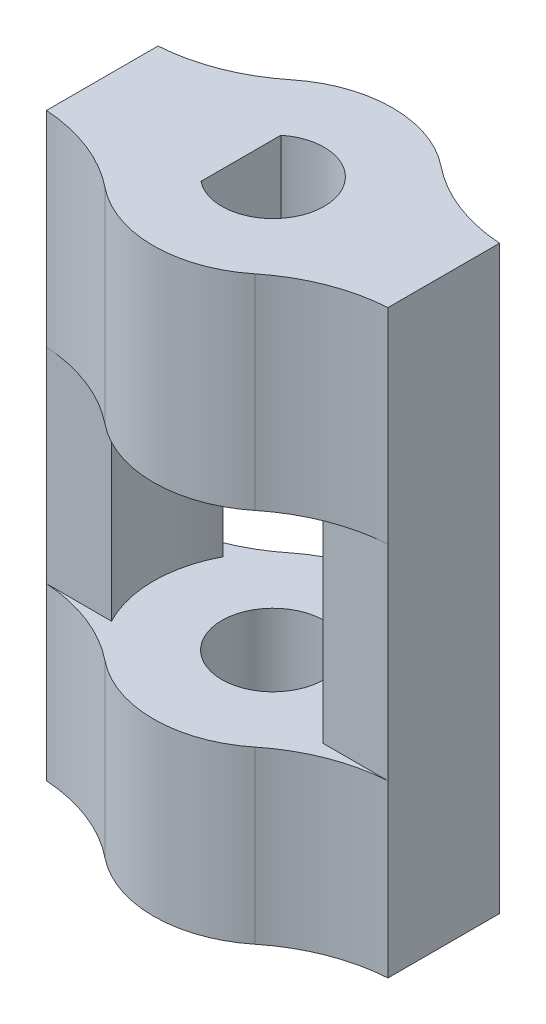
from build123d import *

# Parameters (mm, degrees)
BOSS_EXTRUDE1_DEPTH = 10
BOSS_EXTRUDE2_START = 10
BOSS_EXTRUDE2_DEPTH = 12
BOSS_EXTRUDE3_START = 22
BOSS_EXTRUDE3_DEPTH = 12
FILLET1_R           = 10


with BuildPart() as part:
    # Sketch1 → Boss-Extrude1 (new body)
    # profile 1 of 5: a face of its own
    with BuildSketch(Plane(origin=(0, 0, 0), x_dir=(1, 0, 0), z_dir=(0, 1, 0))):
        with BuildLine():
            Line((-10, 3.266604118), (-10, -3.266604118))
            Line((-10, -3.266604118), (-6.191065945, -3.266604118))
            ThreePointArc((-6.191065945, -3.266604118), (-7, 0), (-6.191065945, 3.266604118))
            Line((-6.191065945, 3.266604118), (-10, 3.266604118))
        make_face()
    # profile 2 of 5: a face of its own
    with BuildSketch(Plane(origin=(0, 0, 0), x_dir=(1, 0, 0), z_dir=(0, 1, 0))):
        with BuildLine():
            ThreePointArc((6.191065945, 3.266604118), (0, 7), (-6.191065945, 3.266604118))
            Line((-6.191065945, 3.266604118), (6.191065945, 3.266604118))
        make_face()
    # profile 3 of 5: a face of its own
    with BuildSketch(Plane(origin=(0, 0, 0), x_dir=(1, 0, 0), z_dir=(0, 1, 0))):
        with BuildLine():
            ThreePointArc((-6.191065945, 3.266604118), (-7, 0), (-6.191065945, -3.266604118))
            Line((-6.191065945, -3.266604118), (6.191065945, -3.266604118))
            ThreePointArc((6.191065945, -3.266604118), (6.794757597, -1.68263757), (7, 0))
            ThreePointArc((7, 0), (6.794757597, 1.68263757), (6.191065945, 3.266604118))
            Line((6.191065945, 3.266604118), (-6.191065945, 3.266604118))
        make_face()
        with BuildLine():
            ThreePointArc((-1.877606485, -2.339785009), (-3, 0), (-1.877606485, 2.339785009))
            ThreePointArc((-1.877606485, 2.339785009), (1.297532378, 2.704886269), (3, 0))
            ThreePointArc((3, 0), (1.297532378, -2.704886269), (-1.877606485, -2.339785009))
        make_face(mode=Mode.SUBTRACT)
    # profile 4 of 5: a face of its own
    with BuildSketch(Plane(origin=(0, 0, 0), x_dir=(1, 0, 0), z_dir=(0, 1, 0))):
        with BuildLine():
            Line((6.191065945, -3.266604118), (-6.191065945, -3.266604118))
            ThreePointArc((-6.191065945, -3.266604118), (0, -7), (6.191065945, -3.266604118))
        make_face()
    # profile 5 of 5: a face of its own
    with BuildSketch(Plane(origin=(0, 0, 0), x_dir=(1, 0, 0), z_dir=(0, 1, 0))):
        with BuildLine():
            ThreePointArc((7, 0), (6.794757597, -1.68263757), (6.191065945, -3.266604118))
            Line((6.191065945, -3.266604118), (10, -3.266604118))
            Line((10, -3.266604118), (10, 3.266604118))
            Line((10, 3.266604118), (6.191065945, 3.266604118))
            ThreePointArc((6.191065945, 3.266604118), (6.794757597, 1.68263757), (7, 0))
        make_face()
    extrude(amount=BOSS_EXTRUDE1_DEPTH)

    # Sketch1<3> → Boss-Extrude2 (add)
    with BuildSketch(Plane(origin=(0, 0, 0), x_dir=(1, 0, 0), z_dir=(0, 1, 0)).offset(BOSS_EXTRUDE2_START)):
        with BuildLine():
            ThreePointArc((7, 0), (6.794757597, -1.68263757), (6.191065945, -3.266604118))
            Line((6.191065945, -3.266604118), (10, -3.266604118))
            Line((10, -3.266604118), (10, 3.266604118))
            Line((10, 3.266604118), (6.191065945, 3.266604118))
            ThreePointArc((6.191065945, 3.266604118), (6.794757597, 1.68263757), (7, 0))
        make_face()
        with BuildLine():
            Line((-10, 3.266604118), (-10, -3.266604118))
            Line((-10, -3.266604118), (-6.191065945, -3.266604118))
            ThreePointArc((-6.191065945, -3.266604118), (-7, 0), (-6.191065945, 3.266604118))
            Line((-6.191065945, 3.266604118), (-10, 3.266604118))
        make_face()
    extrude(amount=BOSS_EXTRUDE2_DEPTH)

    # Sketch1<5> → Boss-Extrude3 (add)
    with BuildSketch(Plane(origin=(0, 0, 0), x_dir=(1, 0, 0), z_dir=(0, 1, 0)).offset(BOSS_EXTRUDE3_START)):
        with BuildLine():
            Line((-10, 3.266604118), (-10, -3.266604118))
            Line((-10, -3.266604118), (-6.191065945, -3.266604118))
            ThreePointArc((-6.191065945, -3.266604118), (0, -7), (6.191065945, -3.266604118))
            Line((6.191065945, -3.266604118), (10, -3.266604118))
            Line((10, -3.266604118), (10, 3.266604118))
            Line((10, 3.266604118), (6.191065945, 3.266604118))
            ThreePointArc((6.191065945, 3.266604118), (0, 7), (-6.191065945, 3.266604118))
            Line((-6.191065945, 3.266604118), (-10, 3.266604118))
        make_face()
        with BuildLine():
            Line((-1.877606485, -2.339785009), (-1.877606485, 2.339785009))
            ThreePointArc((-1.877606485, 2.339785009), (3, 0), (-1.877606485, -2.339785009))
        make_face(mode=Mode.SUBTRACT)
    extrude(amount=BOSS_EXTRUDE3_DEPTH)

    # Fillet1
    # the kernel refuses this fillet: 10 mm, written as the material it adds along each edge
    with BuildSketch(Plane(origin=(6.191065945, 0, 3.266604118), x_dir=(-0.6360609802051742, 0, 0.7716387946833887), z_dir=(0, 1, 0))) as fillet1_piece_1:
        with BuildLine():
            CenterArc((4.859166888, 9.792894401), FILLET1_R, 223.265287812, 35.053552735)
            Line((-2.422714329, 2.939121283), (0, 0))
            ThreePointArc((0, 0), (1.417257009, 0.144973919), (2.834514018, 0))
        make_face()
    extrude(amount=10)
    with BuildSketch(Plane(origin=(-6.191065945, 0, 3.266604118), x_dir=(-1, 0, 0), z_dir=(0, 1, 0)), Plane(origin=(6.191065945, 0, -3.266604118), x_dir=(1, 0, 0), z_dir=(0, 1, 0))) as fillet1_piece_2:
        with BuildLine():
            CenterArc((4.465850779, 9.978399692), FILLET1_R, 231.17987933, 35.053552735)
            ThreePointArc((-1.802923765, 2.18722098), (-0.789594382, 1.185822743), (0, 0))
            Line((0, 0), (3.808934055, 0))
        make_face()
    extrude(amount=10)
    with BuildSketch(Plane(origin=(6.191065945, 22, 3.266604118), x_dir=(1, 0, 0), z_dir=(0, 1, 0))) as fillet1_piece_3:
        with BuildLine():
            CenterArc((4.465850779, -9.978399692), FILLET1_R, 93.766567935, 35.053552735)
            ThreePointArc((-1.802923765, -2.18722098), (-0.789594382, -1.185822743), (0, 0))
            Line((0, 0), (3.808934055, 0))
        make_face()
    extrude(amount=12)
    with BuildSketch(Plane(origin=(-6.191065945, 22, 3.266604118), x_dir=(-1, 0, 0), z_dir=(0, 1, 0))) as fillet1_piece_4:
        with BuildLine():
            CenterArc((4.465850779, 9.978399692), FILLET1_R, 231.17987933, 35.053552735)
            ThreePointArc((-1.802923765, 2.18722098), (-0.789594382, 1.185822743), (0, 0))
            Line((0, 0), (3.808934055, 0))
        make_face()
    extrude(amount=12)
    with BuildSketch(Plane(origin=(-6.191065945, 22, -3.266604118), x_dir=(0.6360609802051819, 0, -0.7716387946833824), z_dir=(0, 1, 0))) as fillet1_piece_5:
        with BuildLine():
            CenterArc((4.859166888, 9.792894401), FILLET1_R, 223.265287812, 35.053552735)
            Line((-2.422714329, 2.939121283), (0, 0))
            ThreePointArc((0, 0), (1.417257009, 0.144973919), (2.834514018, 0))
        make_face()
    extrude(amount=12)
    with BuildSketch(Plane(origin=(6.191065945, 22, -3.266604118), x_dir=(-0.6360609802051733, 0, -0.7716387946833895), z_dir=(0, 1, 0))) as fillet1_piece_6:
        with BuildLine():
            CenterArc((4.859166888, -9.792894401), FILLET1_R, 101.681159453, 35.053552735)
            Line((-2.422714329, -2.939121283), (0, 0))
            ThreePointArc((0, 0), (1.417257009, -0.144973919), (2.834514018, 0))
        make_face()
    extrude(amount=12)
    with BuildSketch(Plane(origin=(-6.191065945, 0, -3.266604118), x_dir=(-1, 0, 0), z_dir=(0, 1, 0))) as fillet1_piece_7:
        with BuildLine():
            CenterArc((4.465850779, -9.978399692), FILLET1_R, 93.766567935, 35.053552735)
            ThreePointArc((-1.802923765, -2.18722098), (-0.789594382, -1.185822743), (0, 0))
            Line((0, 0), (3.808934055, 0))
        make_face()
    extrude(amount=10)


solid = part.part
